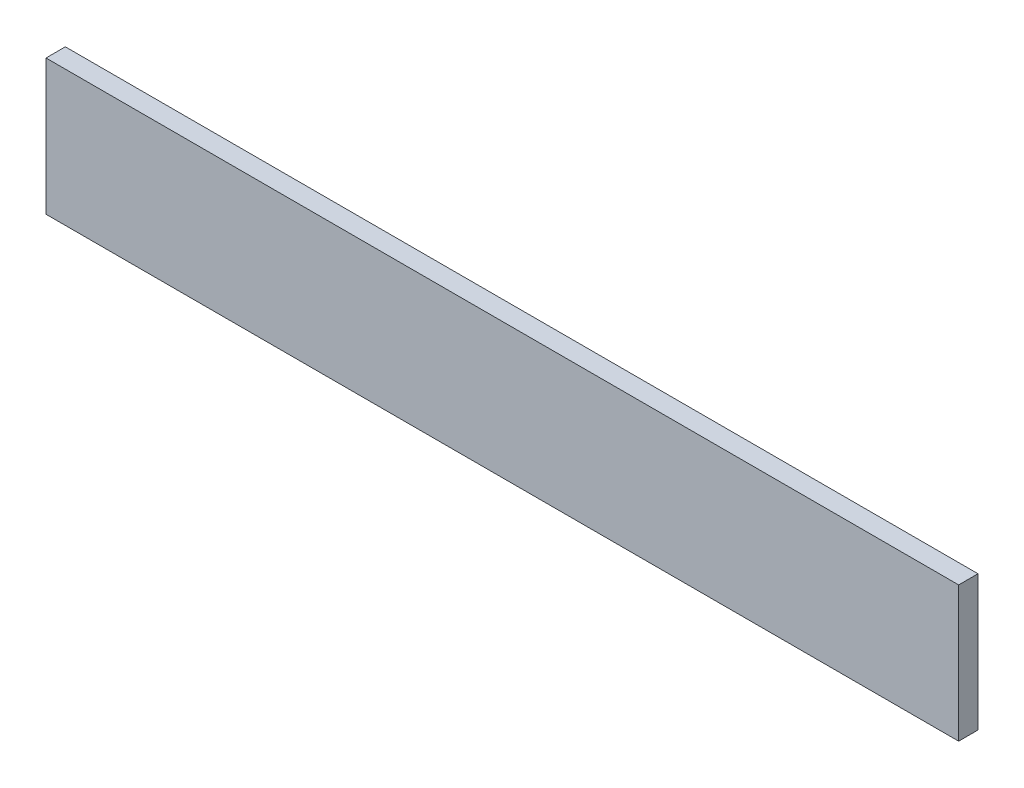
from build123d import *

# Parameters (mm, degrees)
SKETCH_1_W             = 472
SKETCH_1_H             = 70
SM_BASE_FLANGE_1_DEPTH = 10


# Sheet-metal steps are written as plain solids
with BuildPart() as part:
    # Sketch 1 → 基体-法兰1 (new body)
    with BuildSketch(Plane.XY):
        Rectangle(SKETCH_1_W, SKETCH_1_H)
    extrude(amount=-SM_BASE_FLANGE_1_DEPTH)


solid = part.part
